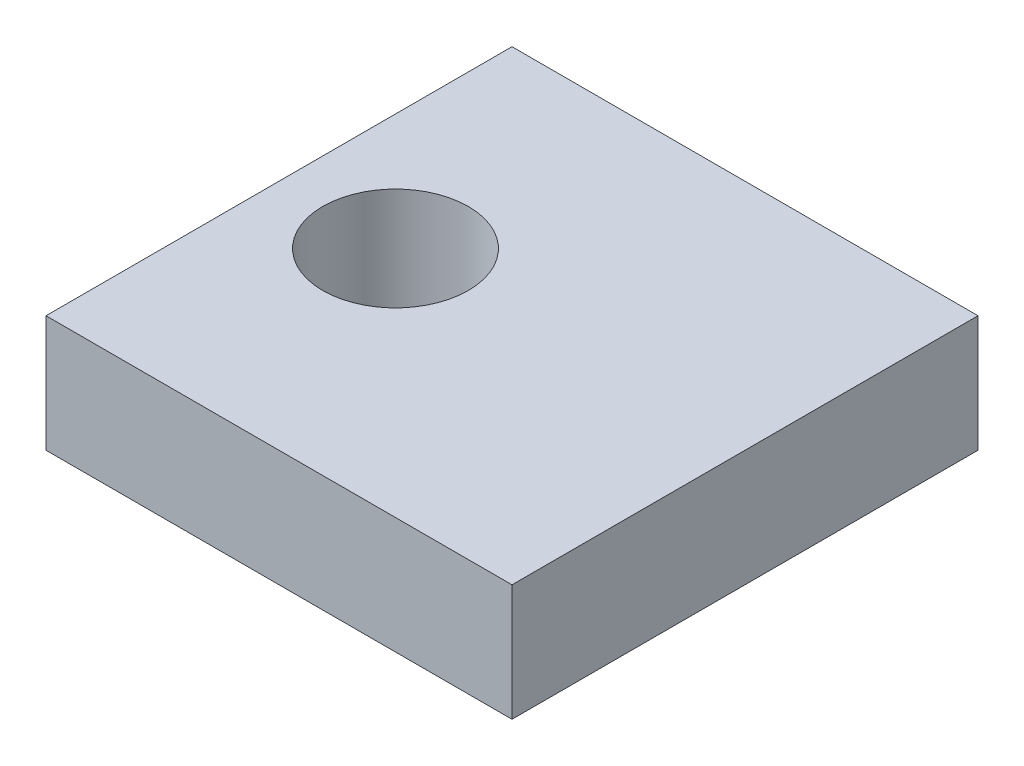
from build123d import *

# Parameters (mm, degrees)
SKETCH1_W               = 101.6
SKETCH1_H               = 101.6
BOSS_EXTRUDE1_DEPTH     = 12.7
CUT_EXTRUDE1_DEPTH      = 77.2
CUT_EXTRUDE1_DEPTH_BACK = 77.2
SKETCH2_R               = 15.875


with BuildPart() as part:
    # Sketch1 → Boss-Extrude1 (new, symmetric)
    with BuildSketch(Plane(origin=(0, 0, 0), x_dir=(1, 0, 0), z_dir=(0, 1, 0))):
        Rectangle(SKETCH1_W, SKETCH1_H)
    extrude(amount=BOSS_EXTRUDE1_DEPTH, both=True)

    # Sketch2 → Cut-Extrude1 (cut, two sides: drawn at the far end of the back side and taken through both)
    with BuildSketch(Plane(origin=(0, 12.7, 0), x_dir=(1, 0, 0), z_dir=(0, 1, 0)).offset(-CUT_EXTRUDE1_DEPTH_BACK)):
        with Locations((-25.4, 0)):
            Circle(SKETCH2_R)
    extrude(amount=CUT_EXTRUDE1_DEPTH + CUT_EXTRUDE1_DEPTH_BACK, mode=Mode.SUBTRACT)


solid = part.part
